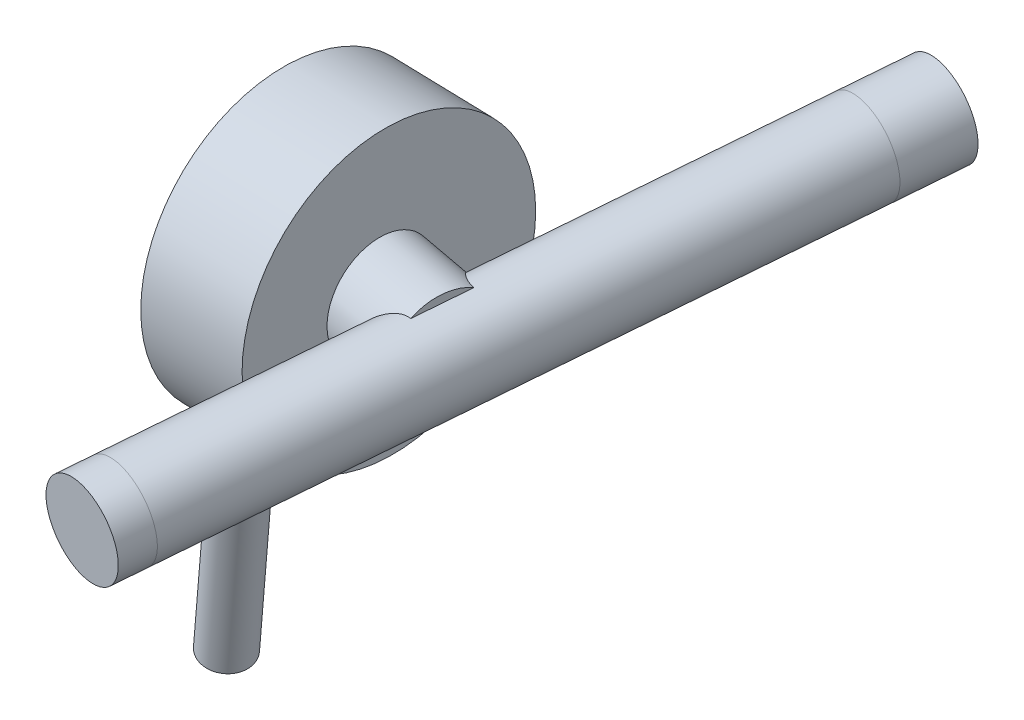
from build123d import *

# Parameters (mm, degrees)
SUSP_FL_UCA_BALL_JOINT_PROFILE_R  = 17
SUSP_FL_LCA_BALL_JOINT_PROFILE_R  = 17
SUSP_FL_UPRIGHT_KINGPIN_START     = -44.924681897
SUSP_FL_UPRIGHT_KINGPIN_OUTLINE_R = 17
SUSP_FL_UPRIGHT_KINGPIN_DEPTH     = 234.300820367
SUSP_FL_UPRIGHT_SPINDLE_PROFILE_R = 20
SUSP_FL_UPRIGHT_ARM_PROFILE_R     = 9
SUSP_FL_HUB_PROFILE_R             = 55


with BuildPart() as part:
    # SUSP_FL_UCA_ball_joint: sweep along a curve in space
    with BuildLine() as susp_fl_uca_ball_joint_path:
        Line((-539.215175, -109.232527, -297.644798), (-534.716988, -107.000649, -323.155287))
    # SUSP_FL_UCA_ball_joint profile (on start of the path) → SUSP_FL_UCA_ball_joint (sweep)
    with BuildSketch(Plane(origin=(-539.215175, -109.232527, -297.644798), x_dir=(-0.9848077563247088, 0, -0.17364815888080395), z_dir=(0.1730071904249639, 0.0858414606043016, -0.981172643168663))):
        Circle(SUSP_FL_UCA_BALL_JOINT_PROFILE_R)
    sweep(path=susp_fl_uca_ball_joint_path.line)


with BuildPart() as body_2:
    # SUSP_FL_LCA_ball_joint: sweep along a curve in space
    with BuildLine() as susp_fl_lca_ball_joint_path:
        Line((-584.249094, -131.577136, -42.2447557), (-579.750906, -129.345257, -67.7552443))
    # SUSP_FL_LCA_ball_joint profile (on start of the path) → SUSP_FL_LCA_ball_joint (sweep)
    with BuildSketch(Plane(origin=(-584.249094, -131.577136, -42.2447557), x_dir=(-0.9848077492574088, 0, -0.17364819896145425), z_dir=(0.17300722977562832, 0.08584149950700166, -0.9811726328265339))):
        Circle(SUSP_FL_LCA_BALL_JOINT_PROFILE_R)
    sweep(path=susp_fl_lca_ball_joint_path.line)


with BuildPart() as susp_fl_upright_kingpin_tool:
    # SUSP_FL_upright_kingpin: read off the stored shape, not the designer's step
    # SUSP_FL_upright_kingpin outline → SUSP_FL_upright_kingpin (new body)
    with BuildSketch(Plane(origin=(0, 0, 0), x_dir=(0.9849205583589563, -0.01507857135321185, 0.17234886250807685), z_dir=(0.17300720713855208, 0.08584148118504255, -0.9811726384210254)).offset(SUSP_FL_UPRIGHT_KINGPIN_START)):
        with Locations((-580.73578395, 134.758317541)):
            Circle(SUSP_FL_UPRIGHT_KINGPIN_OUTLINE_R)
    extrude(amount=SUSP_FL_UPRIGHT_KINGPIN_DEPTH)


with BuildPart() as part_1:
    add(part.part)


with BuildPart() as part_2:
    # SUSP_FL_upright_kingpin: joined with susp_fl_upright_kingpin_tool
    add(part_1.part.fuse(susp_fl_upright_kingpin_tool.part, body_2.part, tol=0.00001))

    # SUSP_FL_upright_spindle: sweep along a curve in space
    with BuildLine() as susp_fl_upright_spindle_path:
        Line((-563.274706, -121.170213, -161.19642), (-613.584449, -120.4, -170))
    # SUSP_FL_upright_spindle profile (on start of the path) → SUSP_FL_upright_spindle (sweep)
    with BuildSketch(Plane(origin=(-563.274706, -121.170213, -161.19642), x_dir=(0.17236845779024892, 0, -0.9850325450252957), z_dir=(-0.9849205586549441, 0.015078562779446367, -0.17234886156670431))):
        Circle(SUSP_FL_UPRIGHT_SPINDLE_PROFILE_R)
    sweep(path=susp_fl_upright_spindle_path.line)

    # SUSP_FL_upright_arm: sweep along a curve in space
    with BuildLine() as susp_fl_upright_arm_path:
        Line((-575.079712, -127.027537, -94.2469055), (-590.293517, -204.990503, -103.750386))
    # SUSP_FL_upright_arm profile (on start of the path) → SUSP_FL_upright_arm (sweep)
    with BuildSketch(Plane(origin=(-575.079712, -127.027537, -94.2469055), x_dir=(-0.9814869975187847, 0.1915287803479187, 0), z_dir=(-0.19017256143460165, -0.9745370695403799, -0.1187935055844866))):
        Circle(SUSP_FL_UPRIGHT_ARM_PROFILE_R)
    sweep(path=susp_fl_upright_arm_path.line)

    # SUSP_FL_hub: sweep along a curve in space
    with BuildLine() as susp_fl_hub_path:
        Line((-593.591303, -120.4, -169.476461), (-633.577596, -120.4, -170.523539))
    # SUSP_FL_hub profile (on start of the path) → SUSP_FL_hub (sweep)
    with BuildSketch(Plane(origin=(-593.591303, -120.4, -169.476461), x_dir=(0.026176949998200826, 0, -0.9996573249312944), z_dir=(-0.9996573249312944, 0, -0.026176949998200826))):
        Circle(SUSP_FL_HUB_PROFILE_R)
    sweep(path=susp_fl_hub_path.line)


solid = part_2.part
